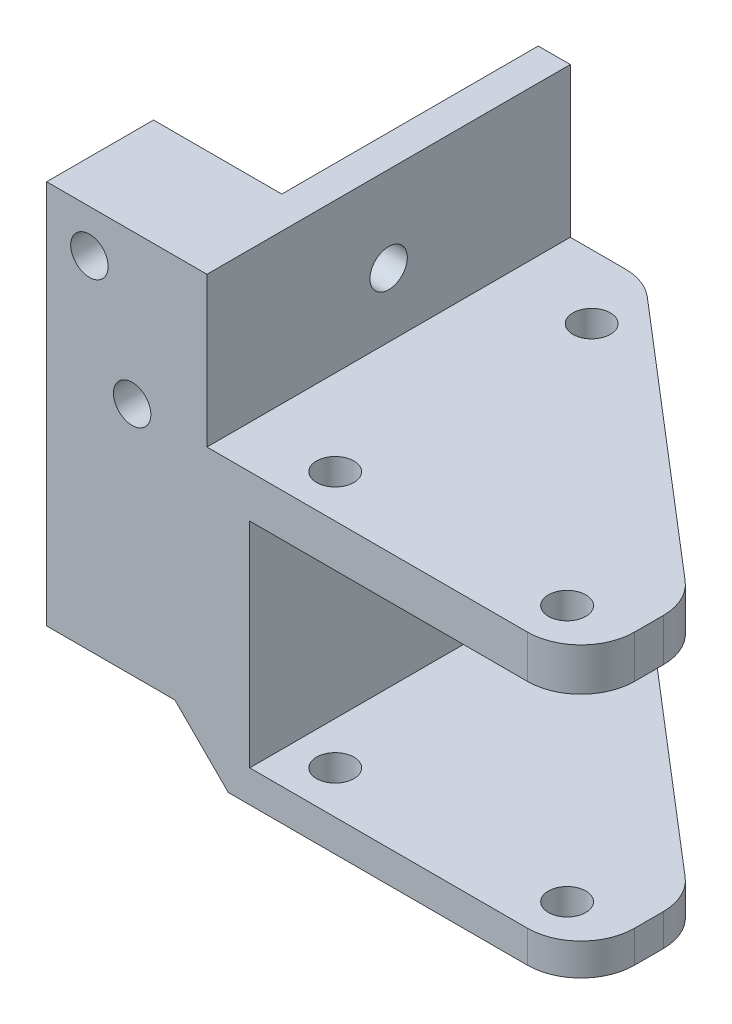
from build123d import *

# Parameters (mm, degrees)
SZKIC1_W                     = 12
SZKIC1_H                     = 18
SZKIC1_R                     = 1.75
DODANIE_WYCI_GNI_CIE1_DEPTH  = 5
SZKIC2_W                     = 12
SZKIC2_H                     = 36
SZKIC2_R                     = 1.75
DODANIE_WYCI_GNI_CIE2_DEPTH  = 5
SZKIC5_W                     = 34
SZKIC5_H                     = 4
DODANIE_WYCI_GNI_CIE5_DEPTH  = 38
SZKIC6_W                     = 7
SZKIC6_H                     = 34
DODANIE_WYCI_GNI_CIE6_DEPTH  = 18
SZKIC7_R                     = 1.75
WYTNIJ_WYCI_GNI_CIE1_DEPTH   = 4
WYTNIJ_WYCI_GNI_CIE2_DEPTH   = 4
ZAOKR_GLENIE1_R              = 5
SZKIC9_W                     = 5
SZKIC9_H                     = 18
DODANIE_WYCI_GNI_CIE7_DEPTH  = 12
DODANIE_WYCI_GNI_CIE8_DEPTH  = 18
SZKIC11_W                    = 4
SZKIC11_H                    = 34
DODANIE_WYCI_GNI_CIE9_DEPTH  = 2
SZKIC12_R                    = 1.75
SZKIC12_W                    = 4
SZKIC12_H                    = 34
DODANIE_WYCI_GNI_CIE10_DEPTH = 3
SFAZOWANIE1_SIZE             = 3
SFAZOWANIE2_SIZE             = 2
SZKIC13_W                    = 3
SZKIC13_H                    = 34
DODANIE_WYCI_GNI_CIE11_DEPTH = 14
SZKIC14_R                    = 1.75
WYTNIJ_WYCI_GNI_CIE3_DEPTH   = 3


with BuildPart() as part:
    # Szkic1 → Dodanie-wyciągnięcie1 (new body)
    with BuildSketch(Plane.XY):
        Rectangle(SZKIC1_W, SZKIC1_H)
        with Locations((-2, 5)):
            Circle(SZKIC1_R, mode=Mode.SUBTRACT)
        with Locations((2, -5)):
            Circle(SZKIC1_R, mode=Mode.SUBTRACT)
    extrude(amount=DODANIE_WYCI_GNI_CIE1_DEPTH)

    # Szkic2 → Dodanie-wyciągnięcie2 (add)
    with BuildSketch(Plane.XY.offset(5)):
        with Locations((0, -9)):
            Rectangle(SZKIC2_W, SZKIC2_H)
        with Locations((-2, 5)):
            Circle(SZKIC2_R, mode=Mode.SUBTRACT)
        with Locations((2, -5)):
            Circle(SZKIC2_R, mode=Mode.SUBTRACT)
    extrude(amount=DODANIE_WYCI_GNI_CIE2_DEPTH)

    # Szkic5 → Dodanie-wyciągnięcie5 (add)
    with BuildSketch(Plane(origin=(6, 0, 0), x_dir=(0, 0, -1), z_dir=(1, 0, 0))):
        with Locations((7, -7)):
            Rectangle(SZKIC5_W, SZKIC5_H)
    extrude(amount=DODANIE_WYCI_GNI_CIE5_DEPTH)

    # Szkic6 → Dodanie-wyciągnięcie6 (add)
    with BuildSketch(Plane.XZ.offset(9)):
        with Locations((9.5, -7)):
            Rectangle(SZKIC6_W, SZKIC6_H)
    extrude(amount=DODANIE_WYCI_GNI_CIE6_DEPTH)

    # Szkic7 → Wytnij-wyciągnięcie1 (cut)
    with BuildSketch(Plane(origin=(0, -5, 0), x_dir=(1, 0, 0), z_dir=(0, 1, 0))):
        with Locations(Location((17, -6, 0), (0, 0, 270))):
            Circle(SZKIC7_R)
        with Locations(Location((17, 18, 0), (0, 0, 270))):
            Circle(SZKIC7_R)
        with Locations(Location((38.7, -6, 0), (0, 0, 270))):
            Circle(SZKIC7_R)
    extrude(amount=-WYTNIJ_WYCI_GNI_CIE1_DEPTH, mode=Mode.SUBTRACT)

    # Szkic8 → Wytnij-wyciągnięcie2 (cut)
    with BuildSketch(Plane(origin=(0, -5, 0), x_dir=(1, 0, 0), z_dir=(0, 1, 0))):
        Polygon((44, 24), (16, 24), (44, 0), align=None)
    extrude(amount=-WYTNIJ_WYCI_GNI_CIE2_DEPTH, mode=Mode.SUBTRACT)

    # Zaokrąglenie1
    zaokr_glenie1_edges = [part.edges().sort_by_distance(p)[0] for p in [
        (44, -7, 10),
        (16, -7, -24),
        (44, -7, 0),
    ]]
    fillet(zaokr_glenie1_edges, radius=ZAOKR_GLENIE1_R)

    # Szkic9 → Dodanie-wyciągnięcie7 (add)
    with BuildSketch(Plane.ZY.offset(-6)):
        with Locations((2.5, -18)):
            Rectangle(SZKIC9_W, SZKIC9_H)
    extrude(amount=DODANIE_WYCI_GNI_CIE7_DEPTH)

    # Szkic10 → Dodanie-wyciągnięcie8 (add)
    with BuildSketch(Plane.XZ.offset(27)):
        Polygon((6, 0), (1, 0), (6, -5), align=None)
    extrude(amount=-DODANIE_WYCI_GNI_CIE8_DEPTH)

    # Szkic11 → Dodanie-wyciągnięcie9 (add)
    with BuildSketch(Plane.XZ.offset(27)):
        with Locations((11, -7)):
            Rectangle(SZKIC11_W, SZKIC11_H)
    extrude(amount=DODANIE_WYCI_GNI_CIE9_DEPTH)

    # Szkic12 → Dodanie-wyciągnięcie10 (add)
    # profile 1 of 2: a face of its own
    with BuildSketch(Plane.XZ.offset(29)):
        with BuildLine():
            Line((44, 2.299674612), (44, 5))
            ThreePointArc((44, 5), (42.535533906, 8.535533906), (39, 10))
            Line((39, 10), (13, 10))
            Line((13, 10), (13, -24))
            Line((13, -24), (14.150379619, -24))
            ThreePointArc((14.150379619, -24), (15.885110858, -23.689425075), (17.404336486, -22.796283012))
            Line((17.404336486, -22.796283012), (42.253956867, -1.496608399))
            ThreePointArc((42.253956867, -1.496608399), (43.542564492, 0.210390565), (44, 2.299674612))
        make_face()
        with Locations(Location((38.7, 6, 0), (0, 0, 90))):
            Circle(SZKIC12_R, mode=Mode.SUBTRACT)
        with Locations(Location((17, -18, 0), (0, 0, 90))):
            Circle(SZKIC12_R, mode=Mode.SUBTRACT)
        with Locations(Location((17, 6, 0), (0, 0, 90))):
            Circle(SZKIC12_R, mode=Mode.SUBTRACT)
    # profile 2 of 2: a face of its own
    with BuildSketch(Plane.XZ.offset(29)):
        with Locations((11, -7)):
            Rectangle(SZKIC12_W, SZKIC12_H)
    extrude(amount=DODANIE_WYCI_GNI_CIE10_DEPTH)

    # Sfazowanie1
    sfazowanie1_edges = [part.edges().sort_by_distance(p)[0] for p in [
        (9, -27, -7),
    ]]
    chamfer(sfazowanie1_edges, length=SFAZOWANIE1_SIZE)

    # Sfazowanie2
    sfazowanie2_edges = [part.edges().sort_by_distance(p)[0] for p in [
        (9, -32, -7),
    ]]
    chamfer(sfazowanie2_edges, length=SFAZOWANIE2_SIZE - 0.0001)  # a hair under: the kernel refuses the full size

    # Szkic13 → Dodanie-wyciągnięcie11 (add)
    with BuildSketch(Plane(origin=(0, -5, 0), x_dir=(1, 0, 0), z_dir=(0, 1, 0))):
        with Locations((7.5, 7)):
            Rectangle(SZKIC13_W, SZKIC13_H)
    extrude(amount=DODANIE_WYCI_GNI_CIE11_DEPTH)

    # Szkic14 → Wytnij-wyciągnięcie3 (cut)
    with BuildSketch(Plane(origin=(9, 0, 0), x_dir=(0, 0, -1), z_dir=(1, 0, 0))):
        with Locations((7, 1)):
            Circle(SZKIC14_R)
    extrude(amount=-WYTNIJ_WYCI_GNI_CIE3_DEPTH, mode=Mode.SUBTRACT)


solid = part.part
